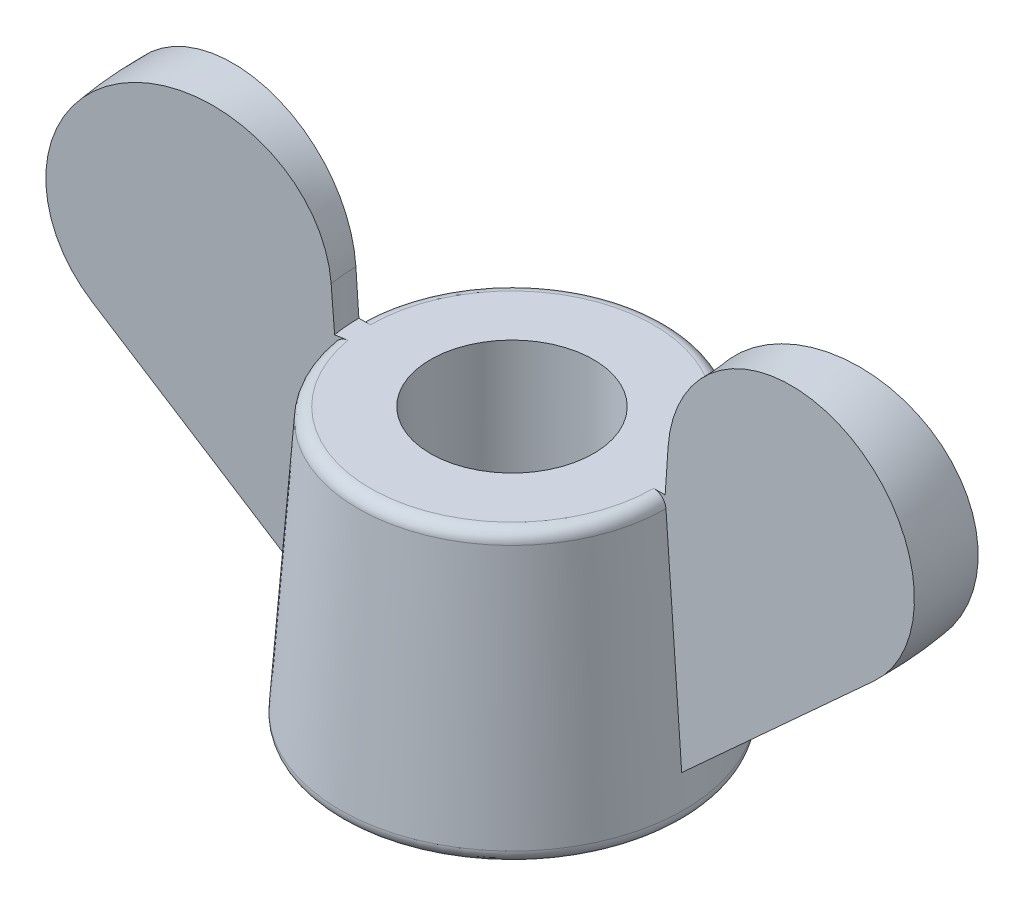
from build123d import *

# Parameters (mm, degrees)
REVOLU_O3_ANGLE                             = 10
CORTE_EXTRUS_O2_DEPTH                       = 10
BROCA_DE_ROSQUEAR_PARA_TARRAXA_DE_M41_D     = 3.3
BROCA_DE_ROSQUEAR_PARA_TARRAXA_DE_M41_DEPTH = 10
BROCA_DE_ROSQUEAR_PARA_TARRAXA_DE_M41_TIP   = 0.991420021
FILETE1_R                                   = 0.25


with BuildPart() as part:
    # Esboço1 → Revolução2 (revolve)
    with BuildSketch(Plane.XY, mode=Mode.PRIVATE) as revolu_o2_sk:
        Polygon((3.1, 5.6), (3.5, 0), (0, 0), (0, 5.6), align=None)
    revolve(revolu_o2_sk.sketch.rotate(Axis((0, 0, 0), (0, 1, 0)), 90), axis=Axis((0, 0, 0), (0, 1, 0)))

    # Esboço3 → Revolução3 (revolve)
    with BuildSketch(Plane.XY):
        with BuildLine():
            Line((3.1, 5.6), (3.159667096, 6.470663935))
            ThreePointArc((3.159667096, 6.470663935), (6.735500159, 8.547793041), (7.332110812, 4.455714945))
            Line((7.332110812, 4.455714945), (3.429154002, 0.895958371))
            Line((3.429154002, 0.895958371), (3.1, 5.6))
        make_face()
    revolve(axis=Axis((0, 0, 0), (0, 1, 0)), revolution_arc=REVOLU_O3_ANGLE)

    # Esboço4 → Corte-extrusão2 (cut)
    with BuildSketch(Plane(origin=(0, 5.6, 0), x_dir=(1, 0, 0), z_dir=(0, 1, 0))):
        with BuildLine():
            Line((0.270182803, -3.088203564), (0, 0))
            Line((0, 0), (-0.270182803, 3.088203564))
            ThreePointArc((-0.270182803, 3.088203564), (-3.088203564, -0.270182803), (0.270182803, -3.088203564))
        make_face()
        with BuildLine():
            Line((0.342968893, -3.920152382), (0.270182803, -3.088203564))
            ThreePointArc((0.270182803, -3.088203564), (-3.088203564, -0.270182803), (-0.270182803, 3.088203564))
            Line((-0.270182803, 3.088203564), (-0.342968893, 3.920152382))
            ThreePointArc((-0.342968893, 3.920152382), (-3.920152382, -0.342968893), (0.342968893, -3.920152382))
        make_face()
    extrude(amount=-CORTE_EXTRUS_O2_DEPTH, mode=Mode.SUBTRACT)

    # Espelhar1: part across face


with BuildPart() as part_1:
    add(part.part)
    add(part.part.mirror(Plane(origin=(0, 2.743434343, 0), x_dir=(0.08715574300604889, 0, 0.9961946980691392), z_dir=(-0.9961946980691393, 0, 0.08715574300604889))))

    # Broca de rosquear para tarraxa de M41
    with Locations(Plane(origin=(0, 5.6, 0), x_dir=(1, 0, 0), z_dir=(0, 1, 0))):
        with Locations((0, 0)):
            Hole(BROCA_DE_ROSQUEAR_PARA_TARRAXA_DE_M41_D / 2, depth=BROCA_DE_ROSQUEAR_PARA_TARRAXA_DE_M41_DEPTH)
            with Locations((0, 0, -(BROCA_DE_ROSQUEAR_PARA_TARRAXA_DE_M41_DEPTH + BROCA_DE_ROSQUEAR_PARA_TARRAXA_DE_M41_TIP / 2))):  # 118° drill point
                Cone(0, BROCA_DE_ROSQUEAR_PARA_TARRAXA_DE_M41_D / 2, BROCA_DE_ROSQUEAR_PARA_TARRAXA_DE_M41_TIP, mode=Mode.SUBTRACT)

    # Filete1
    # the kernel refuses this fillet: 0.25 mm, written as the material it takes off along each edge
    with BuildSketch(Plane(origin=(0, 5.6, 0), x_dir=(0.08715574274766005, 0, 0.9961946980917454), z_dir=(-0.9961946980917454, 0, 0.08715574274766005))) as filete1_piece_1:
        with BuildLine():
            CenterArc((3.1 - FILETE1_R * 0.931119203401, -FILETE1_R), FILETE1_R, 4.08561678, 85.91438322)
            Line((3.1 - FILETE1_R * 0.931119203401, 0), (3.1, 0))
            Line((3.1, 0), (3.1 + FILETE1_R * 0.0663394964294, -FILETE1_R * 0.928752950012))
        make_face()
    revolve(axis=Axis((0, 5.6, 0), (0, 1, 0)), revolution_arc=85, mode=Mode.SUBTRACT)
    with BuildSketch(Plane(origin=(0, 5.6, 0), x_dir=(0.08715574274766005, 0, 0.9961946980917454), z_dir=(-0.9961946980917454, 0, 0.08715574274766005))) as filete1_piece_2_section:
        with BuildLine():
            CenterArc((3.1 - FILETE1_R * 0.931119203401, -FILETE1_R), FILETE1_R, 4.08561678, 85.91438322)
            Line((3.1 - FILETE1_R * 0.931119203401, 0), (3.1, 0))
            Line((3.1, 0), (3.1 + FILETE1_R * 0.0663394964294, -FILETE1_R * 0.928752950012))
        make_face()
    filete1_piece_2 = revolve(axis=Axis((0, 5.6, 0), (0, 1, 0)), revolution_arc=95.759741079, mode=Mode.PRIVATE)
    filete1_piece_2 = split(filete1_piece_2, bisect_by=Plane(origin=(3.054670317, 5.486797578, -0.538620794), z_dir=(-0.17364817766693072, 0, -0.984807753012208)), keep=Keep.TOP, mode=Mode.PRIVATE)
    add(filete1_piece_2, mode=Mode.SUBTRACT)
    with BuildSketch(Plane(origin=(0, 0, 0), x_dir=(0.08715574274766182, 0, 0.9961946980917452), z_dir=(-0.9961946980917452, 0, 0.08715574274766182))) as filete1_piece_3:
        with BuildLine():
            CenterArc((3.5 - FILETE1_R * 1.07397634626, FILETE1_R), FILETE1_R, 270, 94.08561678)
            Line((3.5 - FILETE1_R * 1.07397634626, 0), (3.5, 0))
            Line((3.5, 0), (3.5 - FILETE1_R * 0.0765176464277, FILETE1_R * 1.07124704999))
        make_face()
    revolve(axis=Axis((0, 0, 0), (0, 1, 0)), revolution_arc=180, mode=Mode.SUBTRACT)
    with BuildSketch(Plane(origin=(0, 5.6, 0), x_dir=(-0.08715574274762866, 0, -0.9961946980917481), z_dir=(-0.9961946980917481, 0, 0.08715574274762866))) as filete1_piece_4:
        with BuildLine():
            CenterArc((3.1 - FILETE1_R * 0.931119203401, FILETE1_R), FILETE1_R, 270, 85.91438322)
            Line((3.1 - FILETE1_R * 0.931119203401, 0), (3.1, 0))
            Line((3.1, 0), (3.1 + FILETE1_R * 0.0663394964294, FILETE1_R * 0.928752950012))
        make_face()
    revolve(axis=Axis((0, 5.6, 0), (0, -1, 0)), revolution_arc=85, mode=Mode.SUBTRACT)
    with BuildSketch(Plane(origin=(0, 5.6, 0), x_dir=(-0.08715574274762866, 0, -0.9961946980917481), z_dir=(-0.9961946980917481, 0, 0.08715574274762866))) as filete1_piece_5_section:
        with BuildLine():
            CenterArc((3.1 - FILETE1_R * 0.931119203401, FILETE1_R), FILETE1_R, 270, 85.91438322)
            Line((3.1 - FILETE1_R * 0.931119203401, 0), (3.1, 0))
            Line((3.1, 0), (3.1 + FILETE1_R * 0.0663394964294, FILETE1_R * 0.928752950012))
        make_face()
    filete1_piece_5 = revolve(axis=Axis((0, 5.6, 0), (0, -1, 0)), revolution_arc=95.759741079, mode=Mode.PRIVATE)
    filete1_piece_5 = split(filete1_piece_5, bisect_by=Plane(origin=(3.10179353, 5.486797578, 0), z_dir=(0, 0, 1)), keep=Keep.TOP, mode=Mode.PRIVATE)
    add(filete1_piece_5, mode=Mode.SUBTRACT)
    with BuildSketch(Plane(origin=(0, 5.6, 0), x_dir=(-0.08715574326446912, 0, -0.9961946980465305), z_dir=(0.9961946980465305, 0, -0.08715574326446912))) as filete1_piece_6:
        with BuildLine():
            CenterArc((3.1 - FILETE1_R * 0.931119203401, -FILETE1_R), FILETE1_R, 4.08561678, 85.91438322)
            Line((3.1 + FILETE1_R * 0.0663394964294, -FILETE1_R * 0.928752950012), (3.1, 0))
            Line((3.1, 0), (3.1 - FILETE1_R * 0.931119203401, 0))
        make_face()
    revolve(axis=Axis((0, 5.6, 0), (0, 1, 0)), revolution_arc=85, mode=Mode.SUBTRACT)
    with BuildSketch(Plane(origin=(0, 5.6, 0), x_dir=(-0.08715574326446912, 0, -0.9961946980465305), z_dir=(0.9961946980465305, 0, -0.08715574326446912))) as filete1_piece_7_section:
        with BuildLine():
            CenterArc((3.1 - FILETE1_R * 0.931119203401, -FILETE1_R), FILETE1_R, 4.08561678, 85.91438322)
            Line((3.1 + FILETE1_R * 0.0663394964294, -FILETE1_R * 0.928752950012), (3.1, 0))
            Line((3.1, 0), (3.1 - FILETE1_R * 0.931119203401, 0))
        make_face()
    filete1_piece_7 = revolve(axis=Axis((0, 5.6, 0), (0, 1, 0)), revolution_arc=95.759741079, mode=Mode.PRIVATE)
    filete1_piece_7 = split(filete1_piece_7, bisect_by=Plane(origin=(-2.996372834, 5.561029125, 0.528341377), z_dir=(0.17364817817780473, 0, 0.9848077529221271)), keep=Keep.TOP, mode=Mode.PRIVATE)
    add(filete1_piece_7, mode=Mode.SUBTRACT)
    with BuildSketch(Plane(origin=(0, 0, 0), x_dir=(0.08715574326443595, 0, 0.9961946980465334), z_dir=(0.9961946980465334, 0, -0.08715574326443595))) as filete1_piece_8:
        with BuildLine():
            CenterArc((3.5 - FILETE1_R * 1.07397634626, -FILETE1_R), FILETE1_R, 355.91438322, 94.08561678)
            Line((3.5 - FILETE1_R * 1.07397634626, 0), (3.5, 0))
            Line((3.5, 0), (3.5 - FILETE1_R * 0.0765176464277, -FILETE1_R * 1.07124704999))
        make_face()
    revolve(axis=Axis((0, 0, 0), (0, -1, 0)), revolution_arc=180, mode=Mode.SUBTRACT)
    with BuildSketch(Plane(origin=(0, 5.6, 0), x_dir=(0.08715574326443776, 0, 0.996194698046533), z_dir=(0.996194698046533, 0, -0.08715574326443776))) as filete1_piece_9:
        with BuildLine():
            CenterArc((3.1 - FILETE1_R * 0.931119203401, FILETE1_R), FILETE1_R, 270, 85.91438322)
            Line((3.1 + FILETE1_R * 0.0663394964294, FILETE1_R * 0.928752950012), (3.1, 0))
            Line((3.1, 0), (3.1 - FILETE1_R * 0.931119203401, 0))
        make_face()
    revolve(axis=Axis((0, 5.6, 0), (0, -1, 0)), revolution_arc=85, mode=Mode.SUBTRACT)
    with BuildSketch(Plane(origin=(0, 5.6, 0), x_dir=(0.08715574326443776, 0, 0.996194698046533), z_dir=(0.996194698046533, 0, -0.08715574326443776))) as filete1_piece_10_section:
        with BuildLine():
            CenterArc((3.1 - FILETE1_R * 0.931119203401, FILETE1_R), FILETE1_R, 270, 85.91438322)
            Line((3.1 + FILETE1_R * 0.0663394964294, FILETE1_R * 0.928752950012), (3.1, 0))
            Line((3.1, 0), (3.1 - FILETE1_R * 0.931119203401, 0))
        make_face()
    filete1_piece_10 = revolve(axis=Axis((0, 5.6, 0), (0, -1, 0)), revolution_arc=95.759741079, mode=Mode.PRIVATE)
    filete1_piece_10 = split(filete1_piece_10, bisect_by=Plane(origin=(-3.042596715, 5.561029125, 2e-09), z_dir=(-5.187550944363294e-10, 0, -1.0)), keep=Keep.TOP, mode=Mode.PRIVATE)
    add(filete1_piece_10, mode=Mode.SUBTRACT)


solid = part_1.part
